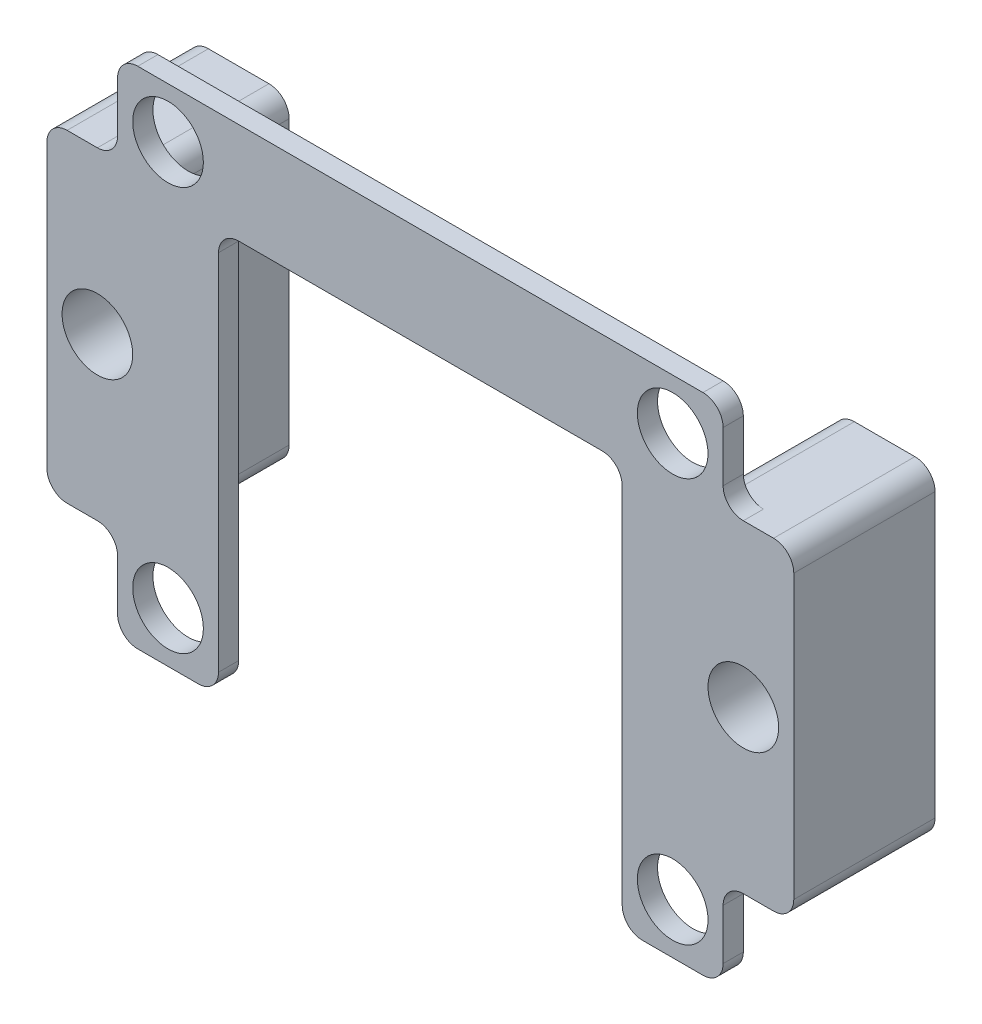
from build123d import *

# Parameters (mm, degrees)
SKETCH1_W             = 10
SKETCH1_H             = 32
SKETCH1_R             = 2.4
BOSS_EXTRUDE1_DEPTH   = 7
BOSS_EXTRUDE1_2_DEPTH = 7
SKETCH3_R             = 1.6
BOSS_EXTRUDE2_DEPTH   = 2
SKETCH2_R             = 3.5
CUT_EXTRUDE2_DEPTH    = 6
SKETCH4_W             = 40
SKETCH4_H             = 40
CUT_EXTRUDE3_DEPTH    = 47.238512087
FILLET1_R             = 2
CHAMFER1_SIZE         = 2


with BuildPart() as part:
    # Sketch1 → Boss-Extrude1 (new, symmetric)
    with BuildSketch(Plane.XY):
        with Locations((-32, 0)):
            Rectangle(SKETCH1_W, SKETCH1_H)
        with Locations((-32, 0)):
            Circle(SKETCH1_R, mode=Mode.SUBTRACT)
    extrude(amount=BOSS_EXTRUDE1_DEPTH, both=True)



with BuildPart() as body_2:
    # Sketch1 → Boss-Extrude1 2 (new, symmetric)
    with BuildSketch(Plane.XY):
        with Locations((32, 0)):
            Rectangle(SKETCH1_W, SKETCH1_H)
        with Locations((32, 0)):
            Circle(SKETCH1_R, mode=Mode.SUBTRACT)
    extrude(amount=BOSS_EXTRUDE1_2_DEPTH, both=True)


with BuildPart() as part_1:
    add(part.part)

    add(body_2.part)  # Boss-Extrude2 merges body 2
    # Sketch3 → Boss-Extrude2 (add)
    with BuildSketch(Plane.XY.offset(7)):
        Polygon((-37, 16), (-30, 16), (-30, 25), (30, 25), (30, 16), (37, 16), (37, -16), (30, -16), (30, -25), (-30, -25), (-30, -16), (-37, -16), align=None)
        with Locations((-25, 20)):
            Circle(SKETCH3_R, mode=Mode.SUBTRACT)
        with Locations((25, 20)):
            Circle(SKETCH3_R, mode=Mode.SUBTRACT)
        with Locations((25, -20)):
            Circle(SKETCH3_R, mode=Mode.SUBTRACT)
        with Locations((-25, -20)):
            Circle(SKETCH3_R, mode=Mode.SUBTRACT)
    extrude(amount=-BOSS_EXTRUDE2_DEPTH)

    # Sketch2 → Cut-Extrude2 (cut)
    with BuildSketch(Plane.XY.offset(7)):
        with Locations((-32, 0)):
            Circle(SKETCH2_R)
        with Locations((32, 0)):
            Circle(SKETCH2_R)
        with Locations((-25, 20)):
            Circle(SKETCH2_R)
        with Locations((25, 20)):
            Circle(SKETCH2_R)
        with Locations((25, -20)):
            Circle(SKETCH2_R)
        with Locations((-25, -20)):
            Circle(SKETCH2_R)
    extrude(amount=-CUT_EXTRUDE2_DEPTH, mode=Mode.SUBTRACT)

    # Sketch4 → Cut-Extrude3 (cut, through all)
    with BuildSketch(Plane(origin=(0, 0, 5), x_dir=(-1, 0, 0), z_dir=(0, 0, -1))):
        with Locations((0, -5)):
            Rectangle(SKETCH4_W, SKETCH4_H)
    extrude(amount=-CUT_EXTRUDE3_DEPTH, mode=Mode.SUBTRACT)

    # Fillet1
    fillet1_edges = [part_1.edges().sort_by_distance(p)[0] for p in [
        (20, -25, 6),
        (20, 15, 6),
        (-20, 15, 6),
        (-20, -25, 6),
        (-27, 16, -1),
        (-27, -16, -1),
        (-30, 16, 6),
        (-30, 25, 6),
        (30, 25, 6),
        (30, 16, 6),
        (37, 16, 0),
        (37, -16, 0),
        (30, -16, 6),
        (30, -25, 6),
        (-30, -25, 6),
        (-30, -16, 6),
        (27, 16, -1),
        (27, -16, -1),
        (-37, 16, 0),
        (-37, -16, 0),
    ]]
    fillet(fillet1_edges, radius=FILLET1_R)

    # Chamfer1
    # the kernel refuses this chamfer: 2 mm, written as the material it takes off along each edge
    with BuildSketch(Plane(origin=(-32, 0, 1), x_dir=(1, 0, 0), z_dir=(0, 1, 0))) as chamfer1_piece_1_section:
        Polygon((2.4 + CHAMFER1_SIZE, 0), (2.4, CHAMFER1_SIZE), (2.4, 0), align=None)
    chamfer1_piece_1 = revolve(axis=Axis((-32, 0, 1), (0, 0, -1)), mode=Mode.PRIVATE)
    chamfer1_piece_1 = chamfer1_piece_1 & Plane(origin=(-32, 0, -0.456047854), x_dir=(1, 0, 0), z_dir=(0, 0, 1)) * Cylinder(3.5, 18, mode=Mode.PRIVATE)
    add(chamfer1_piece_1, mode=Mode.SUBTRACT)
    with BuildSketch(Plane(origin=(32, 0, 1), x_dir=(1, 0, 0), z_dir=(0, 1, 0))) as chamfer1_piece_2_section:
        Polygon((2.4, CHAMFER1_SIZE), (2.4 + CHAMFER1_SIZE, 0), (2.4, 0), align=None)
    chamfer1_piece_2 = revolve(axis=Axis((32, 0, 1), (0, 0, -1)), mode=Mode.PRIVATE)
    chamfer1_piece_2 = chamfer1_piece_2 & Plane(origin=(32, 0, -0.456047854), x_dir=(1, 0, 0), z_dir=(0, 0, 1)) * Cylinder(3.5, 18, mode=Mode.PRIVATE)
    add(chamfer1_piece_2, mode=Mode.SUBTRACT)


solid = part_1.part
